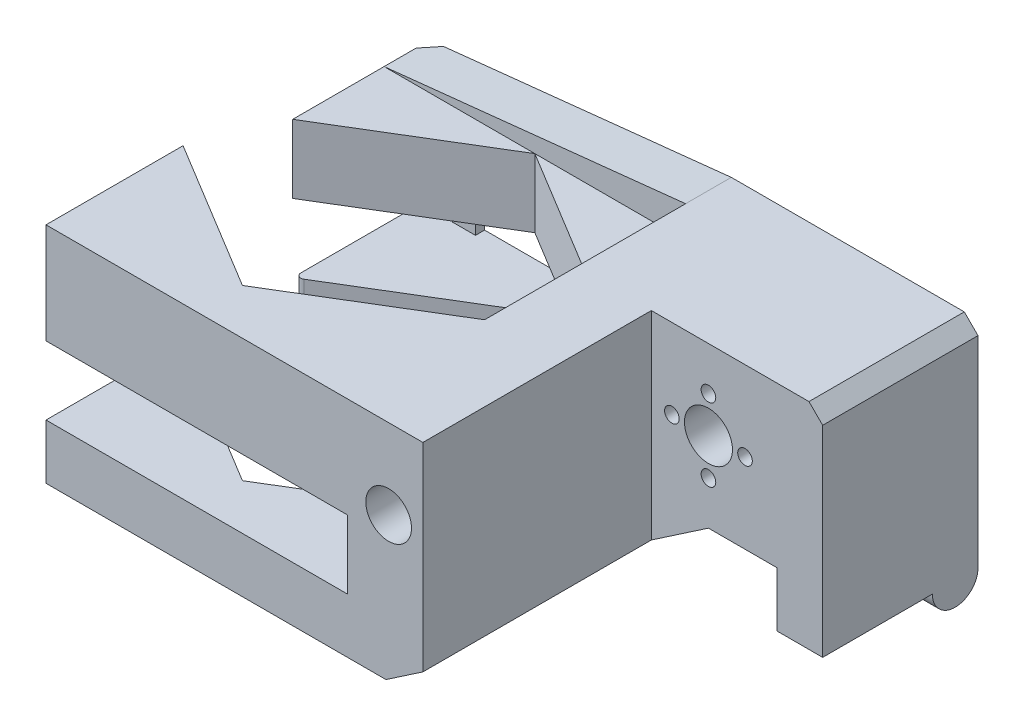
from build123d import *
from build123d.topology import SkipClean

# Parameters (mm, degrees)
SKETCH_1_W            = 50
SKETCH_1_H            = 35
EXTRUDE_1_DEPTH       = 10
HOLE_WIZARD_370_D     = 10.5
HOLE_WIZARD_475_D     = 3.2
SKETCH_6_W            = 10
SKETCH_6_H            = 52
EXTRUDE_2_DEPTH       = 70
EXTRUDE_3_DEPTH       = 52
SKETCH_10_W           = 30
SKETCH_10_H           = 15
SKETCH_10_H_2         = 7
CUT_EXTRUDE_1_DEPTH   = 66
SKETCH_12_W           = 5
SKETCH_12_H           = 15
EXTRUDE_4_DEPTH       = 2
EXTRUDE_5_DEPTH       = 10
RIB_6_REACH           = 107.429
SKETCH_15_WALL_W      = 243.090204886
SKETCH_15_WALL_H      = 10
SKETCH_16_W           = 10
SKETCH_16_H           = 10
EXTRUDE_6_DEPTH       = 17
FILLET_1_RADIUS       = 5
FILLET_1_LENGTH       = 10
CUT_EXTRUDE_3_DEPTH   = 3
EXTRUDE_8_DEPTH       = 2
FILLET_3_R            = 1
SKETCH_20_R           = 5
CUT_EXTRUDE_4_DEPTH   = 106.654483654
CHAMFER_3_SIZE        = 3
SKETCH_22_R           = 1.6
SKETCH_22_R_2         = 4.65
SKETCH_22_R_3         = 5.25
EXTRUDE_9_DEPTH       = 74
EXTRUDE_10_DEPTH      = 49
SKETCH_25_W           = 30
SKETCH_25_H           = 15
CUT_EXTRUDE_5_DEPTH   = 66
SKETCH_26_R           = 12.5
CUT_EXTRUDE_6_DEPTH   = 50
SKETCH_27_W           = 25
SKETCH_27_H           = 70.37051412
SKETCH_27_W_2         = 27.110275364
CUT_EXTRUDE_7_DEPTH   = 50
SKETCH_28_R           = 5
CUT_EXTRUDE_8_DEPTH   = 132.601177488
MIRROR_2_COPY_1_DEPTH = 2


with BuildPart() as part:
    # 草图1 → 凸台-拉伸1 (new body)
    with BuildSketch(Plane.XY):
        Rectangle(SKETCH_1_W, SKETCH_1_H)
    extrude(amount=EXTRUDE_1_DEPTH)

    # Hole Wizard 370 (through all)
    with Locations(Plane.XY.offset(10)):
        with Locations((0, 0)):
            Hole(HOLE_WIZARD_370_D / 2)

    # Hole Wizard 475 (through all)
    with Locations(Plane.XY.offset(10)):
        with Locations((8, 0), (0, 8), (-8, 0), (0, -8)):
            Hole(HOLE_WIZARD_475_D / 2)

    # 草图6 → 凸台-拉伸2 (add)
    with BuildSketch(Plane.ZY.offset(25)):
        with Locations((5, -8.5)):
            Rectangle(SKETCH_6_W, SKETCH_6_H)
    extrude(amount=EXTRUDE_2_DEPTH)

    # 草图9 → 凸台-拉伸3 (add, through all)
    with BuildSketch(Plane(origin=(0, 17.5, 0), x_dir=(1, 0, 0), z_dir=(0, 1, 0))):
        Polygon((-95, -30), (-62, -10), (-95, -10), align=None)
        Polygon((-29, -30), (-29, -10), (-62, -10), align=None)
    extrude(amount=-EXTRUDE_3_DEPTH)

    # 草图10 → 切除-拉伸1 (cut)
    with BuildSketch(Plane.ZY.offset(95)):
        with Locations((15, -12)):
            Rectangle(SKETCH_10_W, SKETCH_10_H)
        with Locations((15, 14)):
            Rectangle(SKETCH_10_W, SKETCH_10_H_2)
    extrude(amount=-CUT_EXTRUDE_1_DEPTH, mode=Mode.SUBTRACT)

    # 草图12 → 凸台-拉伸4 (add)
    with BuildSketch(Plane(origin=(0, 0, 0), x_dir=(-1, 0, 0), z_dir=(0, 0, -1))):
        with Locations((85.5, -12)):
            Rectangle(SKETCH_12_W, SKETCH_12_H)
        with Locations((39.5, -12)):
            Rectangle(SKETCH_12_W, SKETCH_12_H)
        with Locations((62.5, -12)):
            Rectangle(SKETCH_12_W, SKETCH_12_H)
    extrude(amount=-EXTRUDE_4_DEPTH)

    # 草图14 → 凸台-拉伸5 (add)
    with BuildSketch(Plane(origin=(0, 0, 0), x_dir=(-1, 0, 0), z_dir=(0, 0, -1))):
        Polygon((95, 10.5), (29, 17.5), (29, 10.5), align=None)
    extrude(amount=-EXTRUDE_5_DEPTH)

    # 草图15 wall → 筋6 (add, up to next)
    with BuildSketch(Plane(origin=(-12.5, -26, 0), x_dir=(0.82692650207, 0.562310021407, 0), z_dir=(0.562310021407, -0.82692650207, 0)), mode=Mode.PRIVATE) as rib_6_sk1:
        with Locations((0, 5)):
            Rectangle(SKETCH_15_WALL_W, SKETCH_15_WALL_H)
    rib_6_tool1 = extrude(rib_6_sk1.sketch, amount=-RIB_6_REACH, mode=Mode.PRIVATE) - part.part
    add(rib_6_tool1.solids().sort_by_distance((-12.5, -26, 0))[0])

    # 草图16 → 凸台-拉伸6 (add)
    with BuildSketch(Plane.XZ.offset(17.5)):
        with Locations((20, 5)):
            Rectangle(SKETCH_16_W, SKETCH_16_H)
    extrude(amount=EXTRUDE_6_DEPTH)

    # 圆角1: full round fillet: the end face becomes a half cylinder, R = half its width
    fillet_1_face = Plane((20, -34.5, 5), x_dir=(-1, 0, 0), z_dir=(0, -1, 0))  # on the end face: x along it, z out of the body
    fillet_1_slab = fillet_1_face.offset(-FILLET_1_RADIUS / 2) * Box(FILLET_1_LENGTH, 2 * FILLET_1_RADIUS, FILLET_1_RADIUS, mode=Mode.PRIVATE)  # the body's end, R deep
    fillet_1_round = Plane((20, -29.5, 5), x_dir=(0, -1, 0), z_dir=(-1, 0, 0)) * Cylinder(FILLET_1_RADIUS, FILLET_1_LENGTH, mode=Mode.PRIVATE)  # its axis R under the face
    add(fillet_1_slab - fillet_1_round, mode=Mode.SUBTRACT)

    # 草图17 → 切除-拉伸3 (cut)
    with BuildSketch(Plane.XZ.offset(34.5)):
        Polygon((-95, 30), (-62, 10), (-29, 30), (-29, 10), (-17.881583213, 10), (-17.881583213, 0), (-29, 0), (-95, 0), align=None)
    extrude(amount=-CUT_EXTRUDE_3_DEPTH, mode=Mode.SUBTRACT)

    # 草图19 → 凸台-拉伸8 (add)
    with BuildSketch(Plane.ZY.offset(95)):
        with BuildLine():
            Line((25.690911714, -31.5), (0, -31.5))
            ThreePointArc((0, -31.5), (12.845455857, -35.183375195), (25.690911714, -31.5))
        make_face()
    extrude_8 = extrude(amount=-EXTRUDE_8_DEPTH)

    # 圆角3
    fillet_3_edges = [part.edges().sort_by_distance(p)[0] for p in [
        (-95, -25.5, 30),
        (-95, -31.5, 27.845455857),
        (-78.5, -31.5, 20),
    ]]
    fillet(fillet_3_edges, radius=FILLET_3_R)

    # 草图20 → 切除-拉伸4 (cut, through all)
    with BuildSketch(Plane(origin=(0, 0, 0), x_dir=(-1, 0, 0), z_dir=(0, 0, -1))):
        with Locations((20, 0)):
            Circle(SKETCH_20_R)
    extrude(amount=-CUT_EXTRUDE_4_DEPTH, mode=Mode.SUBTRACT)

    # 倒角3
    # the kernel refuses this chamfer: 3 mm, written as the material it takes off along each edge
    with BuildSketch(Plane(origin=(25, 17.5, -7.715048964), x_dir=(0.02749587661058678, -0.9996219169112968, 0), z_dir=(0, 0, 1))) as chamfer_3_piece_1:
        Polygon((CHAMFER_3_SIZE * 0.999621916911, -CHAMFER_3_SIZE * 0.0274958766106), (-CHAMFER_3_SIZE * 0.0274958766106, -CHAMFER_3_SIZE * 0.999621916911), (0, 0), align=None)
    extrude(amount=25.430097928, mode=Mode.SUBTRACT)
    with BuildSketch(Plane(origin=(-95, 18.215048964, 0), x_dir=(0.9996219169112968, 0, -0.02749587661058636), z_dir=(0, -1, 0))) as chamfer_3_piece_2:
        Polygon((CHAMFER_3_SIZE * 0.999621916911, CHAMFER_3_SIZE * 0.0274958766106), (-CHAMFER_3_SIZE * 0.0274958766106, CHAMFER_3_SIZE * 0.999621916911), (0, 0), align=None)
    extrude(amount=30.430097928, mode=Mode.SUBTRACT)
    with BuildSketch(Plane(origin=(-95, -11.784951036, 0), x_dir=(-0.027495876610586778, 0, 0.9996219169112968), z_dir=(0, -1, 0))) as chamfer_3_piece_3:
        Polygon((CHAMFER_3_SIZE * 0.999621916911, -CHAMFER_3_SIZE * 0.0274958766106), (-CHAMFER_3_SIZE * 0.0274958766106, -CHAMFER_3_SIZE * 0.999621916911), (0, 0), align=None)
    extrude(amount=27.430097928, mode=Mode.SUBTRACT)

    # 草图22 → 凸台-拉伸9 (add)
    with SkipClean():  # the faces are left unmerged after this step: merging them gives an invalid solid
        with BuildSketch(Plane.XY.offset(10)):
            Polygon((-29, 17.5), (-29, -31.5), (-20.588235294, -31.5), (0, -17.5), (15, -17.5), (15, -29.5), (25, -29.5), (25, 14.5), (22, 17.5), align=None)
            with Locations((0, -8)):
                Circle(SKETCH_22_R, mode=Mode.SUBTRACT)
            with Locations((0, 8)):
                Circle(SKETCH_22_R, mode=Mode.SUBTRACT)
            with Locations((8, 0)):
                Circle(SKETCH_22_R, mode=Mode.SUBTRACT)
            with Locations((-8, 0)):
                Circle(SKETCH_22_R, mode=Mode.SUBTRACT)
            with Locations((-20, 0)):
                Circle(SKETCH_22_R_2, mode=Mode.SUBTRACT)
            Circle(SKETCH_22_R_3, mode=Mode.SUBTRACT)
        extrude(amount=EXTRUDE_9_DEPTH)
    add(part.part.scale(1), mode=Mode.REPLACE)  # the faces are merged on a copy

    # 草图24 → 凸台-拉伸10 (add)
    with SkipClean():  # the faces are left unmerged after this step: merging them gives an invalid solid
        with BuildSketch(Plane(origin=(0, 17.5, 0), x_dir=(1, 0, 0), z_dir=(0, 1, 0))):
            Polygon((-95, -74), (-95, -54), (-62, -74), (-29, -54), (-29, -74), (-29, -84), (-95, -84), align=None)
        extrude(amount=-EXTRUDE_10_DEPTH)

    # 草图25 → 切除-拉伸5 (cut)
    with SkipClean():  # the faces are left unmerged after this step: merging them gives an invalid solid
        with BuildSketch(Plane.ZY.offset(95)):
            with Locations((69, -12)):
                Rectangle(SKETCH_25_W, SKETCH_25_H)
        extrude(amount=-CUT_EXTRUDE_5_DEPTH, mode=Mode.SUBTRACT)

    # 草图26 → 切除-拉伸6 (cut)
    with BuildSketch(Plane.XY.offset(84)):
        Circle(SKETCH_26_R)
    extrude(amount=-CUT_EXTRUDE_6_DEPTH, mode=Mode.SUBTRACT)

    # 草图27 → 切除-拉伸7 (cut)
    with BuildSketch(Plane.XY.offset(84)):
        Rectangle(SKETCH_27_W, SKETCH_27_H)
        with Locations((26.055137682, 0)):
            Rectangle(SKETCH_27_W_2, SKETCH_27_H)
    extrude(amount=-CUT_EXTRUDE_7_DEPTH, mode=Mode.SUBTRACT)

    # 镜向1: 凸台-拉伸8 across plane
    add(extrude_8.mirror(Plane(origin=(0, 0, 42), x_dir=(1, 0, 0), z_dir=(0, 0, -1))))

    # 草图28 → 切除-拉伸8 (cut, through all)
    with BuildSketch(Plane.XY.offset(84)):
        with Locations(Location((-20, 0, 0), (0, 0, 180))):
            Circle(SKETCH_28_R)
    extrude(amount=-CUT_EXTRUDE_8_DEPTH, mode=Mode.SUBTRACT)

    # 镜向2: 凸台-拉伸8 across plane
    add(extrude_8.mirror(Plane.ZY.offset(62)))

    # 镜向2 copy 1 sketch → 镜向2 copy 1 (add)
    with BuildSketch(Plane(origin=(-29, 0, 84), x_dir=(0, 0, -1), z_dir=(1, 0, 0))):
        with BuildLine():
            Line((25.690911714, -31.5), (0, -31.5))
            ThreePointArc((0, -31.5), (12.845455857, -35.183375195), (25.690911714, -31.5))
        make_face()
    extrude(amount=-MIRROR_2_COPY_1_DEPTH)


solid = part.part
